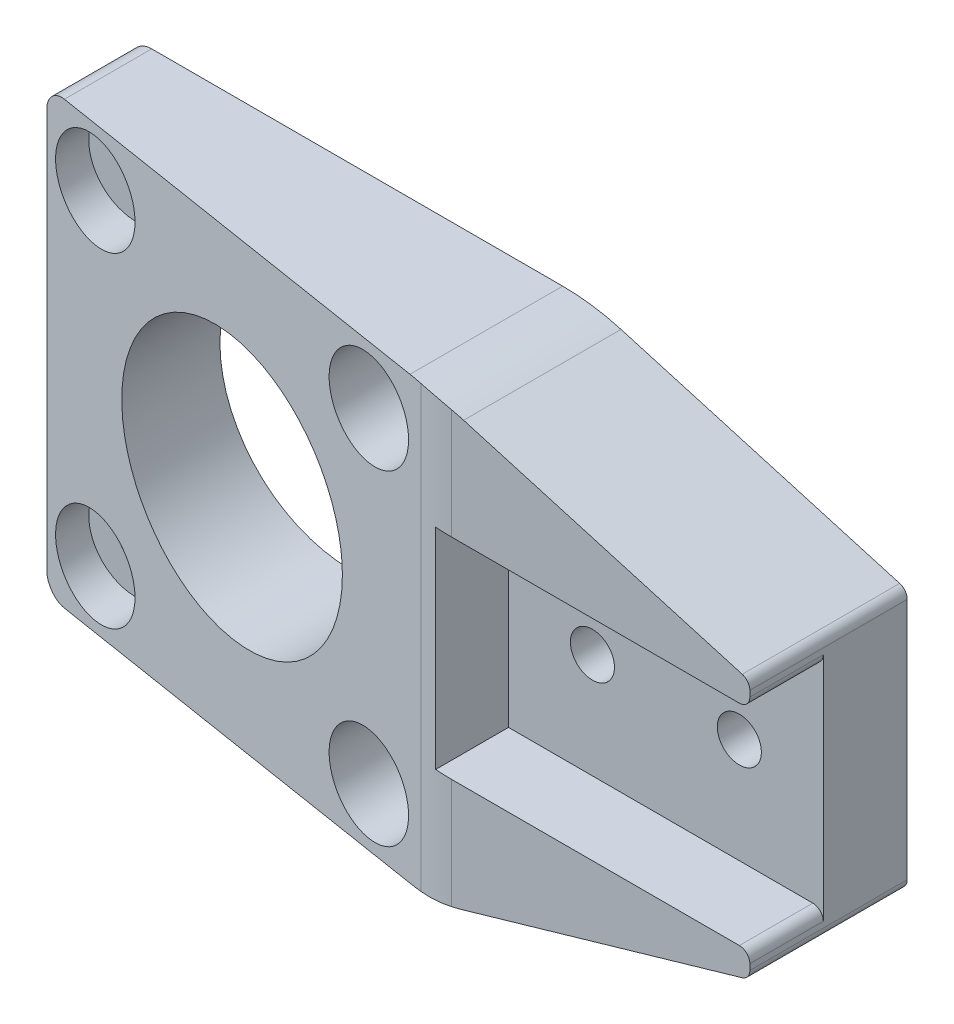
from build123d import *
from OCP.BRepFilletAPI import BRepFilletAPI_MakeChamfer

# Parameters (mm, degrees)
ESQUISSE1_W             = 62
ESQUISSE1_H             = 42
BOSS_EXTRU_1_DEPTH      = 15
ESQUISSE2_R             = 2.1
ESQUISSE2_R_2           = 12.5
ESQUISSE2_R_3           = 1.7
ENL_V_MAT_EXTRU_1_DEPTH = 41.33608806
ESQUISSE4_R             = 4.5
ENL_V_MAT_EXTRU_2_DEPTH = 10
SKETCH1_W               = 20
SKETCH1_H               = 42
CUT_EXTRUDE1_DEPTH      = 41.33608806
SKETCH2_W               = 15
SKETCH2_H               = 42
BOSS_EXTRUDE1_DEPTH     = 40
CUT_EXTRUDE2_DEPTH      = 68.749538744
SKETCH7_W               = 38
SKETCH7_H               = 20
CUT_EXTRUDE3_DEPTH      = 7
SKETCH9_R               = 2.1
CUT_EXTRUDE4_DEPTH      = 56.731499172
CHAMFER1_SIZE           = 38
CHAMFER1_SIZE2          = 11
SKETCH10_W              = 8
SKETCH10_H              = 24.631578948
CUT_EXTRUDE5_DEPTH      = 58.15767665
FILLET2_START           = -1
FILLET2_DEPTH           = 17
FILLET2_START_2         = -22
FILLET2_2_DEPTH         = 44
FILLET4_R               = 2
FILLET5_R               = 1


with BuildPart() as part:
    # Esquisse1 → Boss.-Extru.1 (new body)
    with BuildSketch(Plane.XY):
        Rectangle(ESQUISSE1_W, ESQUISSE1_H)
    extrude(amount=BOSS_EXTRU_1_DEPTH)

    # Esquisse2 → Enlèv. mat.-Extru.1 (cut, through all)
    with BuildSketch(Plane.XY.offset(15)):
        with Locations((21, 11)):
            Circle(ESQUISSE2_R)
        with Locations((21, -11)):
            Circle(ESQUISSE2_R)
        with Locations((-10, 0)):
            Circle(ESQUISSE2_R_2)
        with Locations((-25.5, 15.5)):
            Circle(ESQUISSE2_R_3)
        with Locations((5.5, 15.5)):
            Circle(ESQUISSE2_R_3)
        with Locations((5.5, -15.5)):
            Circle(ESQUISSE2_R_3)
        with Locations((-25.5, -15.5)):
            Circle(ESQUISSE2_R_3)
    extrude(amount=-ENL_V_MAT_EXTRU_1_DEPTH, mode=Mode.SUBTRACT)

    # Esquisse4 → Enlèv. mat.-Extru.2 (cut)
    with BuildSketch(Plane.XY.offset(15)):
        with Locations((-25.5, 15.5)):
            Circle(ESQUISSE4_R)
        with Locations((-25.5, -15.5)):
            Circle(ESQUISSE4_R)
        with Locations((5.5, -15.5)):
            Circle(ESQUISSE4_R)
        with Locations((5.5, 15.5)):
            Circle(ESQUISSE4_R)
    extrude(amount=-ENL_V_MAT_EXTRU_2_DEPTH, mode=Mode.SUBTRACT)

    # Sketch1 → Cut-Extrude1 (cut, through all)
    with BuildSketch(Plane.XY.offset(15)):
        with Locations((21, 0)):
            Rectangle(SKETCH1_W, SKETCH1_H)
    extrude(amount=-CUT_EXTRUDE1_DEPTH, mode=Mode.SUBTRACT)

    # Sketch2 → Boss-Extrude1 (add)
    with BuildSketch(Plane(origin=(11, 0, 0), x_dir=(0, 0, -1), z_dir=(1, 0, 0))):
        with Locations((-7.5, 0)):
            Rectangle(SKETCH2_W, SKETCH2_H)
    extrude(amount=BOSS_EXTRUDE1_DEPTH)

    # Sketch6 → Cut-Extrude2 (cut, through all)
    with BuildSketch(Plane.XZ.offset(21)):
        Polygon((-31, 8), (-31, 15), (13, 15), align=None)
    extrude(amount=-CUT_EXTRUDE2_DEPTH, mode=Mode.SUBTRACT)

    # Sketch7 → Cut-Extrude3 (cut)
    with BuildSketch(Plane.XY.offset(15)):
        with Locations((32, 0)):
            Rectangle(SKETCH7_W, SKETCH7_H)
    extrude(amount=-CUT_EXTRUDE3_DEPTH, mode=Mode.SUBTRACT)

    # Sketch9 → Cut-Extrude4 (cut, through all)
    with BuildSketch(Plane.XY.offset(8)):
        with Locations((21, 0)):
            Circle(SKETCH9_R)
        with Locations((35, 0)):
            Circle(SKETCH9_R)
    extrude(amount=-CUT_EXTRUDE4_DEPTH, mode=Mode.SUBTRACT)

    # Chamfer1: one chamfer whose edges measure the first distance from different faces: ONE call of the kernel's chamfer builder (chamfer() names one face for all edges)
    chamfer1_edges_1 = [part.edges().sort_by_distance(p)[0] for p in [
        (51, 21, 7.5),
    ]]
    chamfer1_side_1 = [part.faces().sort_by_distance(p)[0] for p in [
        (13.76889715, 21, 6.760532838),
    ]]
    chamfer1_edges_2 = [part.edges().sort_by_distance(p)[0] for p in [
        (51, -21, 7.5),
    ]]
    chamfer1_side_2 = [part.faces().sort_by_distance(p)[0] for p in [
        (13.76889715, -21, 6.760532838),
    ]]
    chamfer1 = BRepFilletAPI_MakeChamfer(part.part.solid().wrapped)
    for e in chamfer1_edges_1:
        chamfer1.Add(CHAMFER1_SIZE, CHAMFER1_SIZE2, e.wrapped, chamfer1_side_1[0].wrapped)  # the first distance lies on this face
    for e in chamfer1_edges_2:
        chamfer1.Add(CHAMFER1_SIZE, CHAMFER1_SIZE2, e.wrapped, chamfer1_side_2[0].wrapped)  # the first distance lies on this face
    add(Compound.cast(chamfer1.Shape()), mode=Mode.REPLACE)

    # Sketch10 → Cut-Extrude5 (cut, through all)
    with BuildSketch(Plane(origin=(0, 0, 0), x_dir=(-1, 0, 0), z_dir=(0, 0, -1))):
        with Locations((-47, 0)):
            Rectangle(SKETCH10_W, SKETCH10_H)
    extrude(amount=-CUT_EXTRUDE5_DEPTH, mode=Mode.SUBTRACT)

    # Fillet2: read off the stored shape, not the designer's step
    # Fillet2 outline → Fillet2 (cut)
    with BuildSketch(Plane.XY.offset(FILLET2_START)):
        with BuildLine():
            Line((13, 21), (10.163489291, 21))
            ThreePointArc((10.163489291, 21), (12.9718958, 20.801839634), (15.724650822, 20.211285288))
            Line((15.724650822, 20.211285288), (13, 21))
        make_face()
        with BuildLine():
            ThreePointArc((15.724650822, -20.211285288), (12.9718958, -20.801839634), (10.163489291, -21))
            Line((10.163489291, -21), (13, -21))
            Line((13, -21), (15.724650822, -20.211285288))
        make_face()
    extrude(amount=FILLET2_DEPTH, mode=Mode.SUBTRACT)

    # Fillet2 2 outline → Fillet2 2 (cut)
    with BuildSketch(Plane(origin=(0, 0, 0), x_dir=(1, 0, 0), z_dir=(0, 1, 0)).offset(FILLET2_START_2)):
        with BuildLine():
            Line((11.438667082, -14.751606127), (13, -15))
            Line((13, -15), (14.580968057, -15))
            ThreePointArc((14.580968057, -15), (13.004916429, -14.937804826), (11.438667082, -14.751606127))
        make_face()
    extrude(amount=FILLET2_2_DEPTH, mode=Mode.SUBTRACT)

    # Fillet4
    fillet4_edges = [part.edges().sort_by_distance(p)[0] for p in [
        (-31, 21, 4),
        (-31, -21, 4),
    ]]
    fillet(fillet4_edges, radius=FILLET4_R)

    # Fillet5
    fillet5_edges = [part.edges().sort_by_distance(p)[0] for p in [
        (43, -10, 11.5),
        (43, 10, 11.5),
        (43, 12.315789474, 7.5),
        (43, -12.315789474, 7.5),
    ]]
    fillet(fillet5_edges, radius=FILLET5_R)


solid = part.part
